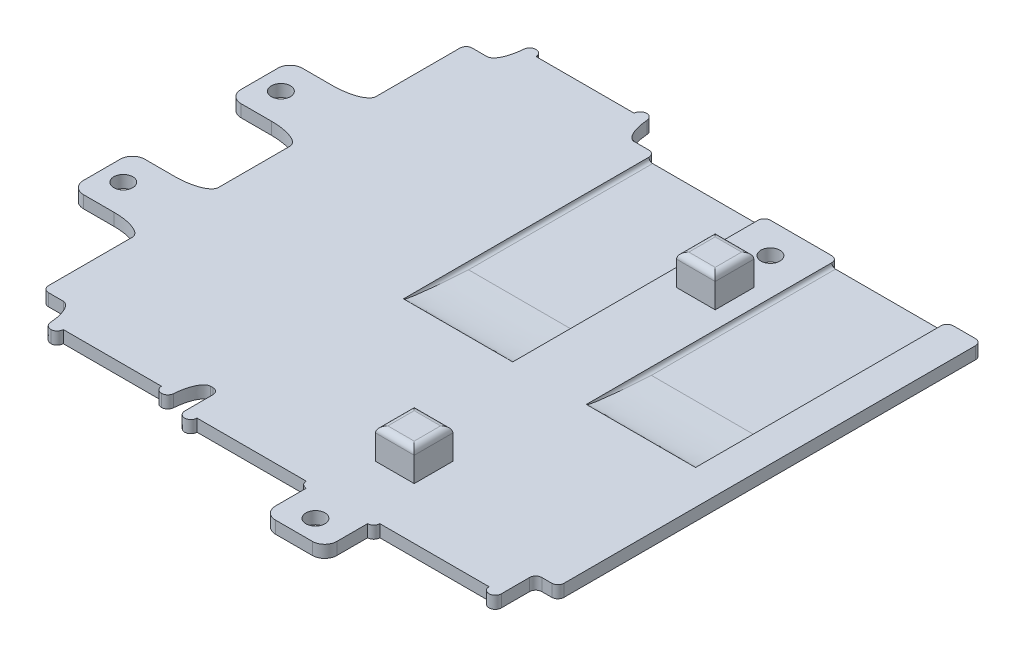
from build123d import *

# Parameters (mm, degrees)
BOSS_EXTRUDE1_DEPTH = 2
SKETCH3_R           = 1.55
CUT_EXTRUDE1_DEPTH  = 2
SKETCH4_W           = 6.3
SKETCH4_H           = 6.3
BOSS_EXTRUDE2_DEPTH = 5
FILLET1_R           = 1
SKETCH5_W           = 17.8
SKETCH5_H           = 40
CUT_EXTRUDE2_DEPTH  = 0.6
FILLET2_SIZE        = 0.6
FILLET2_SIZE_2      = 10
FILLET3_SIZE        = 10
FILLET3_SIZE_2      = 0.6
FILLET4_START       = -41.056486824
FILLET4_DEPTH       = 41.056486824


with BuildPart() as part:
    # Sketch2 → Boss-Extrude1 (new body)
    with BuildSketch(Plane(origin=(0, 0, 0), x_dir=(1, 0, 0), z_dir=(0, 1, 0))):
        with BuildLine():
            add(Edge.make_bspline(
                [(-43.133735674, -31.075024803), (-43.441235903, -26.999732955), (-45.1, -27)],
                knots=[0, 0, 0, 0.872967449, 0.872967449, 0.872967449], degree=2, weights=[0.935039048, 0.744313754, 1]))
            Line((-43.133735674, -31.075024803), (-43.134516898, -31.075080485))
            ThreePointArc((-43.134516898, -31.075080485), (-42.817383359, -31.73317136), (-42.137339421, -32))
            Line((-42.137339421, -32), (-42.1, -32))
            ThreePointArc((-42.1, -32), (-41.392893219, -31.707106781), (-41.1, -31))
            Line((-41.1, -31), (-25.1, -31))
            ThreePointArc((-25.1, -31), (-24.807106781, -31.707106781), (-24.1, -32))
            Line((-24.1, -32), (-24.062660579, -32))
            ThreePointArc((-24.062660579, -32), (-23.382616641, -31.73317136), (-23.065483102, -31.075080485))
            Line((-23.065483102, -31.075080485), (-23.066258848, -31.075026704))
            add(Edge.make_bspline(
                [(-21.1, -27), (-22.758763854, -26.999734864), (-23.066258848, -31.075026704)],
                knots=[0, 0, 0, 0.872967652, 0.872967652, 0.872967652], degree=2, weights=[1, 0.744313695, 0.935039136]))
            Line((-21.1, -27), (-20.7, -27))
            ThreePointArc((-20.7, -27), (-19.992893219, -27.292893219), (-19.7, -28))
            Line((-19.7, -28), (-19.7, -32.6))
            ThreePointArc((-19.7, -32.6), (-19.407106781, -33.307106781), (-18.7, -33.6))
            ThreePointArc((-18.7, -33.6), (-17.992893219, -33.307106781), (-17.7, -32.6))
            Line((-17.7, -32.6), (0.1, -32.6))
            ThreePointArc((0.1, -32.6), (0.392893219, -33.307106781), (1.1, -33.6))
            Line((1.1, -33.6), (1.1, -38.6))
            ThreePointArc((1.1, -38.6), (1.685786438, -40.014213562), (3.1, -40.6))
            Line((3.1, -40.6), (9.1, -40.6))
            ThreePointArc((9.1, -40.6), (10.514213562, -40.014213562), (11.1, -38.6))
            Line((11.1, -38.6), (11.1, -33.6))
            ThreePointArc((11.1, -33.6), (11.807106781, -33.307106781), (12.1, -32.6))
            Line((12.1, -32.6), (29.9, -32.6))
            ThreePointArc((29.9, -32.6), (30.192893219, -33.307106781), (30.9, -33.6))
            ThreePointArc((30.9, -33.6), (31.607106781, -33.307106781), (31.9, -32.6))
            Line((31.9, -32.6), (31.9, -28))
            ThreePointArc((31.9, -28), (32.192893219, -27.292893219), (32.9, -27))
            Line((32.9, -27), (34.519316028, -27))
            ThreePointArc((34.519316028, -27), (35.22642281, -26.707106781), (35.519316028, -26))
            Line((35.519316028, -26), (35.519316028, 41.056486824))
            ThreePointArc((35.519316028, 41.056486824), (35.22642281, 41.763593605), (34.519316028, 42.056486824))
            Line((34.519316028, 42.056486824), (30.9, 42.056486824))
            ThreePointArc((30.9, 42.056486824), (30.192893219, 41.763593605), (29.9, 41.056486824))
            Line((29.9, 41.056486824), (12.1, 41.056486824))
            ThreePointArc((12.1, 41.056486824), (11.807106781, 41.763593605), (11.1, 42.056486824))
            Line((11.1, 42.056486824), (1.1, 42.056486824))
            ThreePointArc((1.1, 42.056486824), (0.392893219, 41.763593605), (0.1, 41.056486824))
            Line((0.1, 41.056486824), (-17.7, 41.056486824))
            ThreePointArc((-17.7, 41.056486824), (-17.992893219, 41.763593605), (-18.7, 42.056486824))
            Line((-18.7, 42.056486824), (-21.1, 42.056486824))
            add(Edge.make_bspline(
                [(-23.066264546, 46.131511613), (-22.758764127, 42.056219704), (-21.1, 42.056486824)],
                knots=[0.127032551, 0.127032551, 0.127032551, 1, 1, 1], degree=2, weights=[0.935039048, 0.744313754, 1]))
            Line((-23.066264546, 46.131511613), (-23.065483102, 46.13156731))
            ThreePointArc((-23.065483102, 46.13156731), (-23.382616641, 46.789658184), (-24.062660579, 47.056486824))
            Line((-24.062660579, 47.056486824), (-24.1, 47.056486824))
            ThreePointArc((-24.1, 47.056486824), (-24.807106781, 46.763593605), (-25.1, 46.056486824))
            Line((-25.1, 46.056486824), (-41.1, 46.056486824))
            ThreePointArc((-41.1, 46.056486824), (-41.392893219, 46.763593605), (-42.1, 47.056486824))
            Line((-42.1, 47.056486824), (-42.137339421, 47.056486824))
            ThreePointArc((-42.137339421, 47.056486824), (-42.817383359, 46.789658184), (-43.134516898, 46.13156731))
            Line((-43.134516898, 46.13156731), (-43.133741152, 46.131513528))
            add(Edge.make_bspline(
                [(-45.1, 42.056486824), (-43.441236146, 42.056221689), (-43.133741152, 46.131513528)],
                knots=[0.127032348, 0.127032348, 0.127032348, 1, 1, 1], degree=2, weights=[1, 0.744313695, 0.935039136]))
            Line((-45.1, 42.056486824), (-47.5, 42.056486824))
            ThreePointArc((-47.5, 42.056486824), (-48.207106781, 41.763593605), (-48.5, 41.056486824))
            Line((-48.5, 41.056486824), (-48.5, 27.370991216))
            add(Edge.make_bspline(
                [(-53.5, 25.370991216), (-48.5, 25.370991216), (-48.5, 27.370991216)],
                knots=[0, 0, 0, 1, 1, 1], degree=2, weights=[1, 0.707106781, 1]))
            Line((-53.5, 25.370991216), (-58.5, 25.370991216))
            ThreePointArc((-58.5, 25.370991216), (-59.914213562, 24.785204778), (-60.5, 23.370991216))
            Line((-60.5, 23.370991216), (-60.5, 17.370991216))
            ThreePointArc((-60.5, 17.370991216), (-59.914213562, 15.956777654), (-58.5, 15.370991216))
            Line((-58.5, 15.370991216), (-53.5, 15.370991216))
            add(Edge.make_bspline(
                [(-48.5, 13.370991216), (-48.5, 15.370991216), (-53.5, 15.370991216)],
                knots=[0, 0, 0, 1, 1, 1], degree=2, weights=[1, 0.707106781, 1]))
            Line((-48.5, 13.370991216), (-48.5, 1.685495608))
            add(Edge.make_bspline(
                [(-53.5, -0.314504392), (-48.5, -0.314504392), (-48.5, 1.685495608)],
                knots=[0, 0, 0, 1, 1, 1], degree=2, weights=[1, 0.707106781, 1]))
            Line((-53.5, -0.314504392), (-58.5, -0.314504392))
            ThreePointArc((-58.5, -0.314504392), (-59.914213562, -0.90029083), (-60.5, -2.314504392))
            Line((-60.5, -2.314504392), (-60.5, -8.314504392))
            ThreePointArc((-60.5, -8.314504392), (-59.914213562, -9.728717954), (-58.5, -10.314504392))
            Line((-58.5, -10.314504392), (-53.5, -10.314504392))
            add(Edge.make_bspline(
                [(-48.5, -12.314504392), (-48.5, -10.314504392), (-53.5, -10.314504392)],
                knots=[0, 0, 0, 1, 1, 1], degree=2, weights=[1, 0.707106781, 1]))
            Line((-48.5, -12.314504392), (-48.5, -26))
            ThreePointArc((-48.5, -26), (-48.207106781, -26.707106781), (-47.5, -27))
            Line((-47.5, -27), (-45.1, -27))
        make_face()
    extrude(amount=BOSS_EXTRUDE1_DEPTH)

    # Sketch3 → Cut-Extrude1 (cut)
    with BuildSketch(Plane(origin=(0, 2, 0), x_dir=(1, 0, 0), z_dir=(0, 1, 0))):
        with Locations(Location((6.1, 37.056486824, 0), (0, 0, 90))):
            Circle(SKETCH3_R)
        with Locations(Location((6.1, -37.1, 0), (0, 0, 90))):
            Circle(SKETCH3_R)
        with Locations(Location((-57, -5.314504392, 0), (0, 0, 90))):
            Circle(SKETCH3_R)
        with Locations(Location((-57, 20.370991216, 0), (0, 0, 90))):
            Circle(SKETCH3_R)
    extrude(amount=-CUT_EXTRUDE1_DEPTH, mode=Mode.SUBTRACT)

    # Sketch4 → Boss-Extrude2 (add)
    with BuildSketch(Plane(origin=(0, 2, 0), x_dir=(1, 0, 0), z_dir=(0, 1, 0))):
        with Locations((6.1, -21)):
            Rectangle(SKETCH4_W, SKETCH4_H)
        with Locations((6.1, 28.056486824)):
            Rectangle(SKETCH4_W, SKETCH4_H)
    extrude(amount=BOSS_EXTRUDE2_DEPTH)

    # Fillet1
    fillet1_edges = [part.edges().sort_by_distance(p)[0] for p in [
        (2.95, 7, 21),
        (6.1, 7, 24.15),
        (9.25, 7, 21),
        (6.1, 7, 17.85),
        (2.95, 7, -28.056486824),
        (6.1, 7, -24.906486824),
        (9.25, 7, -28.056486824),
        (6.1, 7, -31.206486824),
    ]]
    fillet(fillet1_edges, radius=FILLET1_R)

    # Sketch5 → Cut-Extrude2 (cut)
    with BuildSketch(Plane(origin=(0, 2, 0), x_dir=(1, 0, 0), z_dir=(0, 1, 0))):
        with Locations((-8.8, 21.056486824)):
            Rectangle(SKETCH5_W, SKETCH5_H)
        with Locations((21, 21.056486824)):
            Rectangle(SKETCH5_W, SKETCH5_H)
    extrude(amount=-CUT_EXTRUDE2_DEPTH, mode=Mode.SUBTRACT)

    # Fillet2
    # a fillet whose section is not a circle: 10, 0.6 mm, written as the material it adds along each edge
    with BuildSketch(Plane(origin=(29.9, 1.4, -1.056486824), x_dir=(0, 1, 0), z_dir=(-1, 0, 0))) as fillet2_piece_1_section:
        with BuildLine():
            Bezier((FILLET2_SIZE, 0), (0, 0), (0, FILLET2_SIZE_2), weights=[1, 0.707106781, 1])
            Line((0, FILLET2_SIZE_2), (0, 0))
            Line((0, 0), (FILLET2_SIZE, 0))
        make_face()
    fillet2_piece_1 = extrude(amount=42.8, mode=Mode.PRIVATE)
    fillet2_piece_1 = split(fillet2_piece_1, bisect_by=Plane(origin=(0.1, 1.4, -1.056486824), z_dir=(1, 0, 0)), keep=Keep.TOP, mode=Mode.PRIVATE)
    add(fillet2_piece_1)

    # Fillet3
    # a fillet whose section is not a circle: 10, 0.6 mm, written as the material it adds along each edge
    with BuildSketch(Plane(origin=(25.1, 1.4, -1.056486824), x_dir=(0, 0, -1), z_dir=(-1, 0, 0))) as fillet3_piece_1:
        with BuildLine():
            Bezier((FILLET3_SIZE, 0), (0, 0), (0, -FILLET3_SIZE_2), weights=[1, 0.707106781, 1])
            Line((0, -FILLET3_SIZE_2), (0, 0))
            Line((0, 0), (FILLET3_SIZE, 0))
        make_face()
    extrude(amount=67.8)

    # Fillet4: read off the stored shape, not the designer's step
    # Fillet4 outline → Fillet4 (add)
    with BuildSketch(Plane.XY.offset(FILLET4_START)):
        with BuildLine():
            Line((0.1, 1.4), (0.1, 2))
            ThreePointArc((0.1, 2), (-0.075735931, 1.575735931), (-0.5, 1.4))
            Line((-0.5, 1.4), (0.1, 1.4))
        make_face()
        with BuildLine():
            Line((-17.7, 1.4), (-17.1, 1.4))
            ThreePointArc((-17.1, 1.4), (-17.524264069, 1.575735931), (-17.7, 2))
            Line((-17.7, 2), (-17.7, 1.4))
        make_face()
        with BuildLine():
            ThreePointArc((29.9, 2), (29.724264069, 1.575735931), (29.3, 1.4))
            Line((29.3, 1.4), (29.9, 1.4))
            Line((29.9, 1.4), (29.9, 2))
        make_face()
        with BuildLine():
            ThreePointArc((12.7, 1.4), (12.275735931, 1.575735931), (12.1, 2))
            Line((12.1, 2), (12.1, 1.4))
            Line((12.1, 1.4), (12.7, 1.4))
        make_face()
    extrude(amount=FILLET4_DEPTH)


solid = part.part
